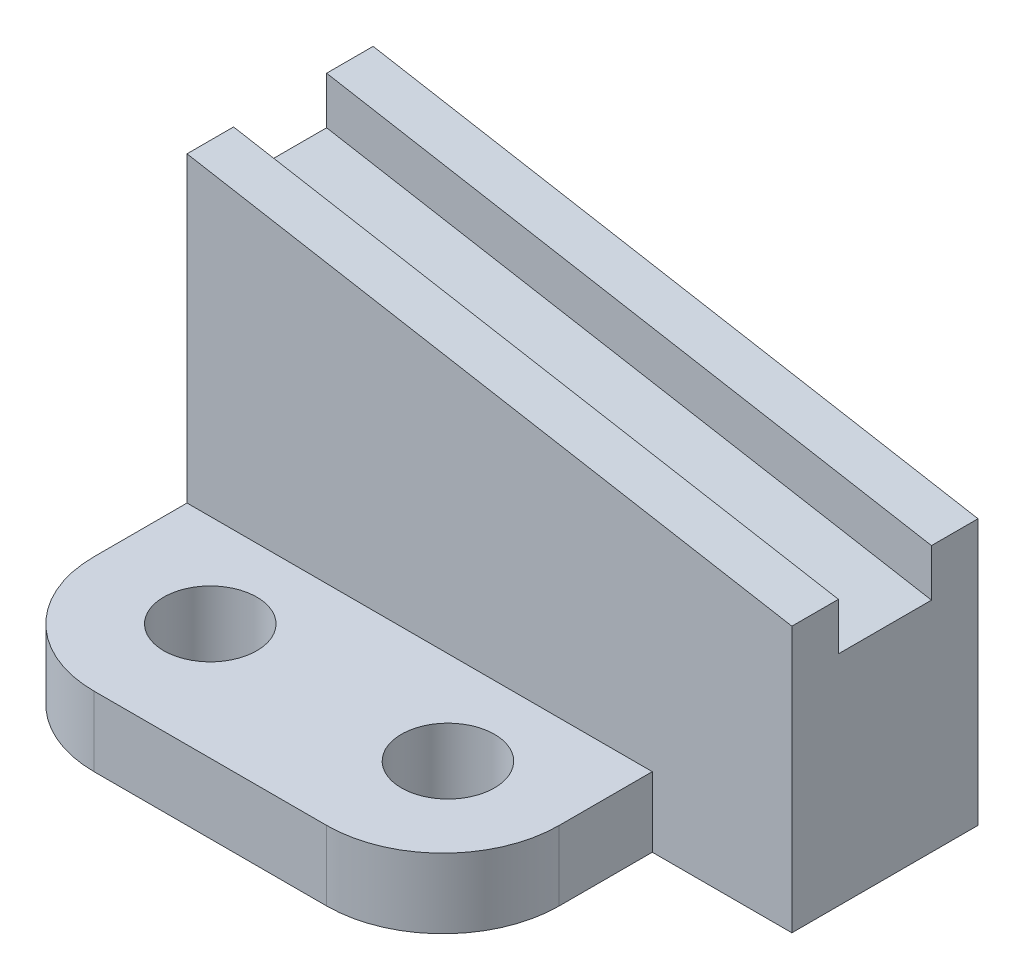
from build123d import *

# Parameters (mm, degrees)
RESSALTO_EXTRUS_O1_DEPTH = 40
ESBO_O4_W                = 171.630568717
ESBO_O4_H                = 20
CORTE_EXTRUS_O3_DEPTH    = 10
ESBO_O5_W                = 100
ESBO_O5_H                = 15
RESSALTO_EXTRUS_O2_DEPTH = 45
FILETE6_R                = 25
FILETE7_R                = 25
ESBO_O7_R                = 10
CORTE_EXTRUS_O4_DEPTH    = 132.657158163


with BuildPart() as part:
    # Esboço1 → Ressalto-extrusão1 (new body)
    with BuildSketch(Plane.XY):
        Polygon((-53.29532416, 9.300830565), (76.70467584, 9.300830565), (76.70467584, 66.378323073), (-53.29532416, 89.300830565), align=None)
    extrude(amount=RESSALTO_EXTRUS_O1_DEPTH)

    # Esboço4 → Corte-extrusão3 (cut)
    with BuildSketch(Plane(origin=(13.664290772, 77.494043834, 0), x_dir=(0.9848077530122075, -0.17364817766693377, 0), z_dir=(0.1736481776669338, 0.9848077530122076, 0))):
        with Locations((8.431345703, -20)):
            Rectangle(ESBO_O4_W, ESBO_O4_H)
    extrude(amount=-CORTE_EXTRUS_O3_DEPTH, mode=Mode.SUBTRACT)

    # Esboço5 → Ressalto-extrusão2 (add)
    with BuildSketch(Plane.XY.offset(40)):
        with Locations((-3.29532416, 16.800830565)):
            Rectangle(ESBO_O5_W, ESBO_O5_H)
    extrude(amount=RESSALTO_EXTRUS_O2_DEPTH)

    # Filete6
    filete6_edges = [part.edges().sort_by_distance(p)[0] for p in [
        (-53.29532416, 16.800830565, 85),
    ]]
    fillet(filete6_edges, radius=FILETE6_R)

    # Filete7
    filete7_edges = [part.edges().sort_by_distance(p)[0] for p in [
        (46.70467584, 16.800830565, 85),
    ]]
    fillet(filete7_edges, radius=FILETE7_R)

    # Esboço7 → Corte-extrusão4 (cut, through all)
    with BuildSketch(Plane(origin=(0, 24.300830565, 0), x_dir=(1, 0, 0), z_dir=(0, 1, 0))):
        with Locations((-28.29532416, -60)):
            Circle(ESBO_O7_R)
        with Locations((22.777677051, -60)):
            Circle(ESBO_O7_R)
    extrude(amount=-CORTE_EXTRUS_O4_DEPTH, mode=Mode.SUBTRACT)


solid = part.part
